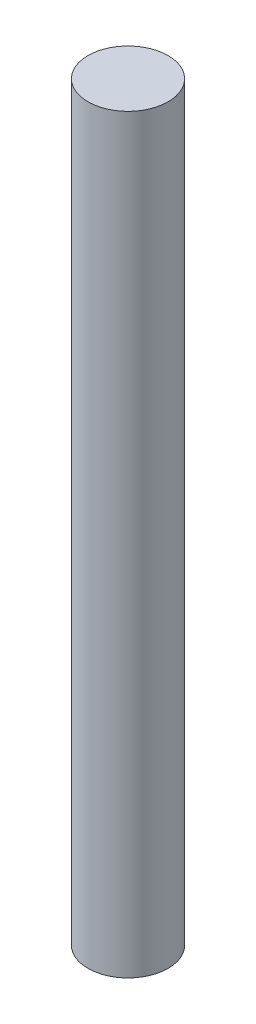
from build123d import *

# Parameters (mm, degrees)
SKETCH_1_R      = 1
EXTRUDE_1_DEPTH = 18.74


with BuildPart() as part:
    # 草图1 → 凸台-拉伸1 (new body)
    with BuildSketch(Plane(origin=(0, 0, 0), x_dir=(1, 0, 0), z_dir=(0, 1, 0))):
        Circle(SKETCH_1_R)
    extrude(amount=EXTRUDE_1_DEPTH)


solid = part.part
